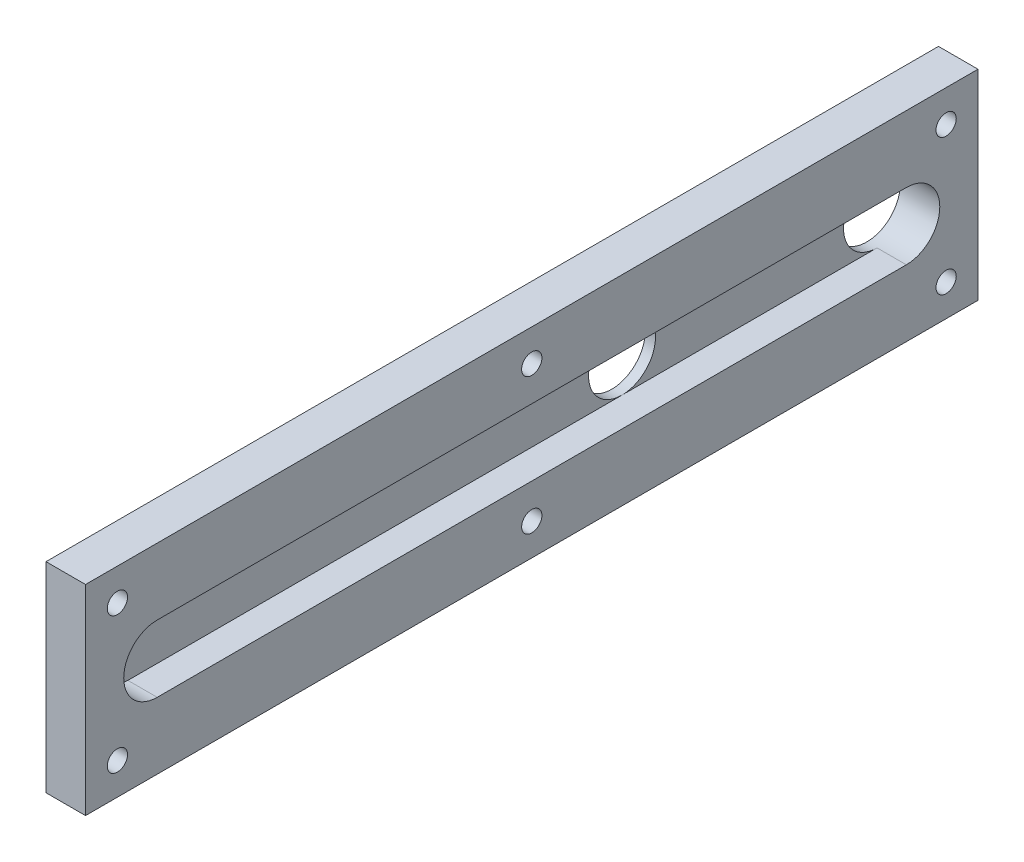
from build123d import *

# Parameters (mm, degrees)
SKETCH1_W              = 177.8
SKETCH1_H              = 39.878
BOSS_EXTRUDE1_DEPTH    = 7.874
F_10_32_TAPPED_HOLE1_D = 4.0386
BOSS_EXTRUDE2_DEPTH    = 2.032


with BuildPart() as part:
    # Sketch1 → Boss-Extrude1 (new body)
    with BuildSketch(Plane(origin=(0, 0, 0), x_dir=(0, 0, -1), z_dir=(1, 0, 0))):
        Rectangle(SKETCH1_W, SKETCH1_H)
        with BuildLine():
            Line((-74.621306688, 6.6675), (74.621306688, 6.6675))
            ThreePointArc((74.621306688, 6.6675), (81.288806688, 0), (74.621306688, -6.6675))
            Line((74.621306688, -6.6675), (-74.621306688, -6.6675))
            ThreePointArc((-74.621306688, -6.6675), (-81.288806688, 0), (-74.621306688, 6.6675))
        make_face(mode=Mode.SUBTRACT)
    extrude(amount=BOSS_EXTRUDE1_DEPTH)

    # #10-32 Tapped Hole1 (through all)
    with Locations(Plane(origin=(7.874, 0, 0), x_dir=(0, 0, -1), z_dir=(1, 0, 0))):
        with Locations((-82.55, 13.589), (-82.55, -13.589), (0, -13.589), (82.55, -13.589), (82.55, 13.589), (0, 13.589)):
            Hole(F_10_32_TAPPED_HOLE1_D / 2)

    # Sketch5 → Boss-Extrude2 (add)
    with BuildSketch(Plane.ZY):
        with BuildLine():
            Line((-23.821306653, 6.6675), (-74.621306688, 6.6675))
            ThreePointArc((-74.621306688, 6.6675), (-67.953806688, 0), (-74.621306688, -6.6675))
            Line((-74.621306688, -6.6675), (-23.82130668, -6.6675))
            ThreePointArc((-23.82130668, -6.6675), (-30.488806688, 1.3e-08), (-23.821306653, 6.6675))
        make_face()
        with BuildLine():
            Line((74.621306688, 6.6675), (-23.821306653, 6.6675))
            ThreePointArc((-23.821306653, 6.6675), (-17.153806688, -1.3e-08), (-23.82130668, -6.6675))
            Line((-23.82130668, -6.6675), (74.621306688, -6.6675))
            ThreePointArc((74.621306688, -6.6675), (81.288806688, 0), (74.621306688, 6.6675))
        make_face()
    extrude(amount=-BOSS_EXTRUDE2_DEPTH)


solid = part.part
